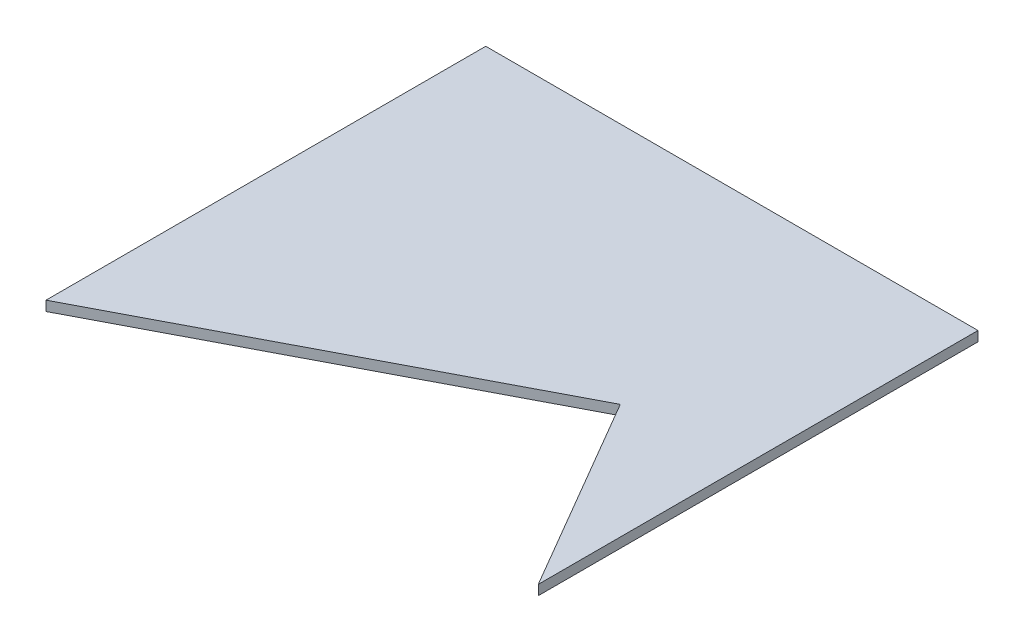
from build123d import *

# Parameters (mm, degrees)
BOSS_EXTRUDE1_DEPTH = 3


with BuildPart() as part:
    # Sketch1 → Boss-Extrude1 (new body)
    with BuildSketch(Plane(origin=(0, 0, 0), x_dir=(1, 0, 0), z_dir=(0, 1, 0))):
        Polygon((-75, -97), (40, -37), (75, -97), (75, 37), (-75, 37), align=None)
    extrude(amount=BOSS_EXTRUDE1_DEPTH)


solid = part.part
